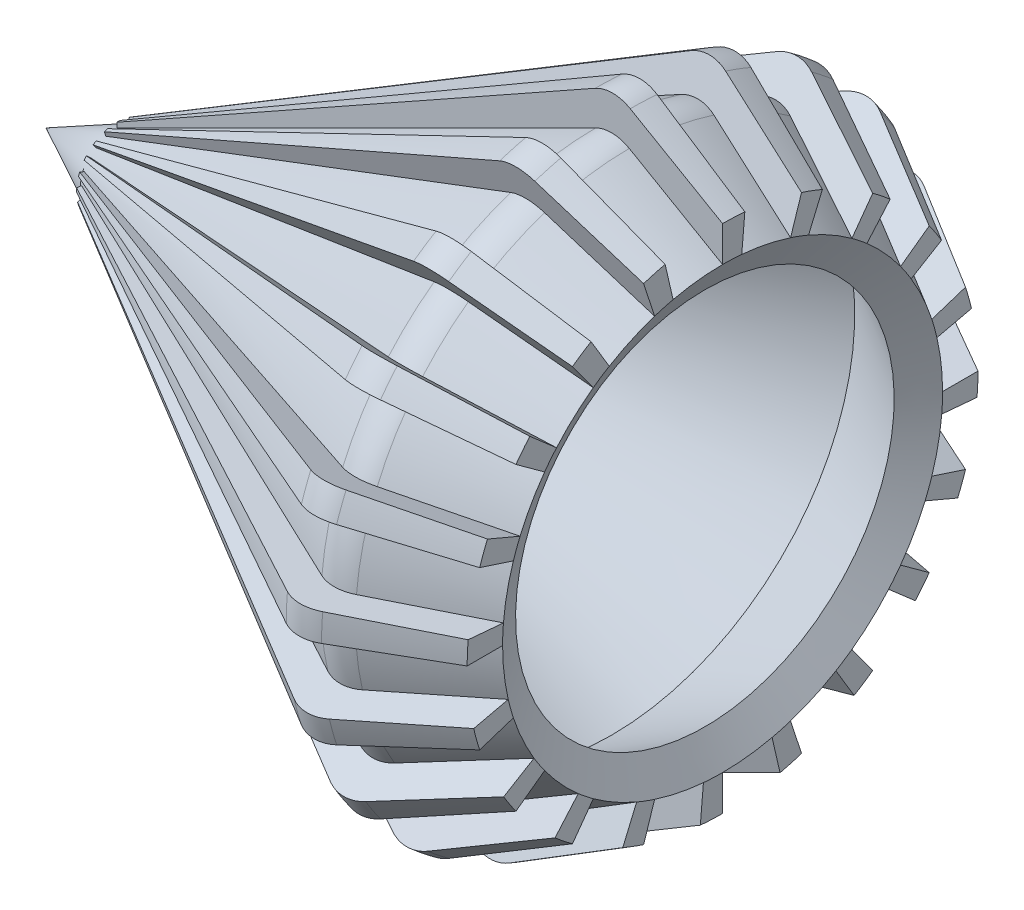
from build123d import *

# Parameters (mm, degrees)
REVOLVE8_ANGLE    = 5
CIRPATTERN3_COUNT = 20
FILLET2_R         = 12.7


with BuildPart() as part:
    # Sketch2 → Revolve1 (revolve)
    with BuildSketch(Plane.XY):
        Polygon((39.369890216, 78.869783286), (0, 101.6), (-203.2, 0), (-174.801936686, 0), (-0.432231925, 87.184852381), (33.019890216, 67.871260658), align=None)
    revolve(axis=Axis((33.461450024, 0, 0), (-1, 0, 0)))


with BuildPart() as body_2:
    # Sketch3 → Revolve8 (revolve)
    with BuildSketch(Plane.XY):
        Polygon((-177.8, 14.461868907), (0, 114.3), (39.369890216, 91.569783286), (39.369890216, 78.869783286), (0, 101.6), (-177.8, 12.7), align=None)
    revolve(axis=Axis((95.945299933, 0, 0), (-1, 0, 0)), revolution_arc=REVOLVE8_ANGLE)


with BuildPart() as cirpattern3_1:
    # CirPattern3: pattern copy
    add(body_2.part.rotate(Axis((-279.640332464, 0, 0), (1, 0, 0)), 1 * 360 / CIRPATTERN3_COUNT))


with BuildPart() as cirpattern3_2:
    # CirPattern3: pattern copy
    add(body_2.part.rotate(Axis((-279.640332464, 0, 0), (1, 0, 0)), 2 * 360 / CIRPATTERN3_COUNT))


with BuildPart() as cirpattern3_3:
    # CirPattern3: pattern copy
    add(body_2.part.rotate(Axis((-279.640332464, 0, 0), (1, 0, 0)), 3 * 360 / CIRPATTERN3_COUNT))


with BuildPart() as cirpattern3_4:
    # CirPattern3: pattern copy
    add(body_2.part.rotate(Axis((-279.640332464, 0, 0), (1, 0, 0)), 4 * 360 / CIRPATTERN3_COUNT))


with BuildPart() as cirpattern3_5:
    # CirPattern3: pattern copy
    add(body_2.part.rotate(Axis((-279.640332464, 0, 0), (1, 0, 0)), 5 * 360 / CIRPATTERN3_COUNT))


with BuildPart() as cirpattern3_6:
    # CirPattern3: pattern copy
    add(body_2.part.rotate(Axis((-279.640332464, 0, 0), (1, 0, 0)), 6 * 360 / CIRPATTERN3_COUNT))


with BuildPart() as cirpattern3_7:
    # CirPattern3: pattern copy
    add(body_2.part.rotate(Axis((-279.640332464, 0, 0), (1, 0, 0)), 7 * 360 / CIRPATTERN3_COUNT))


with BuildPart() as cirpattern3_8:
    # CirPattern3: pattern copy
    add(body_2.part.rotate(Axis((-279.640332464, 0, 0), (1, 0, 0)), 8 * 360 / CIRPATTERN3_COUNT))


with BuildPart() as cirpattern3_9:
    # CirPattern3: pattern copy
    add(body_2.part.rotate(Axis((-279.640332464, 0, 0), (1, 0, 0)), 9 * 360 / CIRPATTERN3_COUNT))


with BuildPart() as cirpattern3_10:
    # CirPattern3: pattern copy
    add(body_2.part.rotate(Axis((-279.640332464, 0, 0), (1, 0, 0)), 10 * 360 / CIRPATTERN3_COUNT))


with BuildPart() as cirpattern3_11:
    # CirPattern3: pattern copy
    add(body_2.part.rotate(Axis((-279.640332464, 0, 0), (1, 0, 0)), 11 * 360 / CIRPATTERN3_COUNT))


with BuildPart() as cirpattern3_12:
    # CirPattern3: pattern copy
    add(body_2.part.rotate(Axis((-279.640332464, 0, 0), (1, 0, 0)), 12 * 360 / CIRPATTERN3_COUNT))


with BuildPart() as cirpattern3_13:
    # CirPattern3: pattern copy
    add(body_2.part.rotate(Axis((-279.640332464, 0, 0), (1, 0, 0)), 13 * 360 / CIRPATTERN3_COUNT))


with BuildPart() as cirpattern3_14:
    # CirPattern3: pattern copy
    add(body_2.part.rotate(Axis((-279.640332464, 0, 0), (1, 0, 0)), 14 * 360 / CIRPATTERN3_COUNT))


with BuildPart() as cirpattern3_15:
    # CirPattern3: pattern copy
    add(body_2.part.rotate(Axis((-279.640332464, 0, 0), (1, 0, 0)), 15 * 360 / CIRPATTERN3_COUNT))


with BuildPart() as cirpattern3_16:
    # CirPattern3: pattern copy
    add(body_2.part.rotate(Axis((-279.640332464, 0, 0), (1, 0, 0)), 16 * 360 / CIRPATTERN3_COUNT))


with BuildPart() as cirpattern3_17:
    # CirPattern3: pattern copy
    add(body_2.part.rotate(Axis((-279.640332464, 0, 0), (1, 0, 0)), 17 * 360 / CIRPATTERN3_COUNT))


with BuildPart() as cirpattern3_18:
    # CirPattern3: pattern copy
    add(body_2.part.rotate(Axis((-279.640332464, 0, 0), (1, 0, 0)), 18 * 360 / CIRPATTERN3_COUNT))


with BuildPart() as cirpattern3_19:
    # CirPattern3: pattern copy
    add(body_2.part.rotate(Axis((-279.640332464, 0, 0), (1, 0, 0)), 19 * 360 / CIRPATTERN3_COUNT))

    # Combine1: union body 2, CirPattern3_1, CirPattern3_2, CirPattern3_3, part, CirPattern3_4, CirPattern3_5, CirPattern3_6, CirPattern3_7, CirPattern3_8, CirPattern3_9, CirPattern3_10, CirPattern3_11, CirPattern3_12, CirPattern3_13, CirPattern3_15, CirPattern3_14, CirPattern3_16, CirPattern3_17, CirPattern3_18
    add(body_2.part)
    add(cirpattern3_1.part)
    add(cirpattern3_2.part)
    add(cirpattern3_3.part)
    add(part.part)
    add(cirpattern3_4.part)
    add(cirpattern3_5.part)
    add(cirpattern3_6.part)
    add(cirpattern3_7.part)
    add(cirpattern3_8.part)
    add(cirpattern3_9.part)
    add(cirpattern3_10.part)
    add(cirpattern3_11.part)
    add(cirpattern3_12.part)
    add(cirpattern3_13.part)
    add(cirpattern3_15.part)
    add(cirpattern3_14.part)
    add(cirpattern3_16.part)
    add(cirpattern3_17.part)
    add(cirpattern3_18.part)

    # Fillet2
    fillet2_edges = [cirpattern3_19.edges().sort_by_distance(p)[0] for p in [
        (0, 71.153422968, 89.452112328),
        (0, 50.030233707, 88.428138707),
        (0, 40.028703678, 107.061631231),
        (0, 20.255782137, 99.560349989),
        (0, 4.985695976, 114.191211727),
        (0, -11.501446519, 100.946900537),
        (0, -30.545346386, 110.142960802),
        (0, -42.132833454, 92.452065121),
        (0, -63.086397421, 95.313149462),
        (0, -68.639965094, 74.90737742),
        (0, -89.452112328, 71.153422968),
        (0, -88.428138707, 50.030233707),
        (0, -107.061631231, 40.028703678),
        (0, -99.560349989, 20.255782137),
        (0, -114.191211727, 4.985695976),
        (0, -100.946900537, -11.501446519),
        (0, -110.142960802, -30.545346386),
        (0, -92.452065121, -42.132833454),
        (0, -95.313149462, -63.086397421),
        (0, -74.90737742, -68.639965094),
        (0, -71.153422968, -89.452112328),
        (0, -50.030233707, -88.428138707),
        (0, -40.028703678, -107.061631231),
        (0, -20.255782137, -99.560349989),
        (0, -4.985695976, -114.191211727),
        (0, 11.501446519, -100.946900537),
        (0, 30.545346386, -110.142960802),
        (0, 42.132833454, -92.452065121),
        (0, 63.086397421, -95.313149462),
        (0, 68.639965094, -74.90737742),
        (0, 89.452112328, -71.153422968),
        (0, 88.428138707, -50.030233707),
        (0, 107.061631231, -40.028703678),
        (0, 99.560349989, -20.255782137),
        (0, 100.946900537, 11.501446519),
        (0, 92.452065121, 42.132833454),
        (0, 74.90737742, 68.639965094),
        (0, 95.313149462, 63.086397421),
        (0, 110.142960802, 30.545346386),
        (0, 114.191211727, -4.985695976),
    ]]
    fillet(fillet2_edges, radius=FILLET2_R)


solid = cirpattern3_19.part
